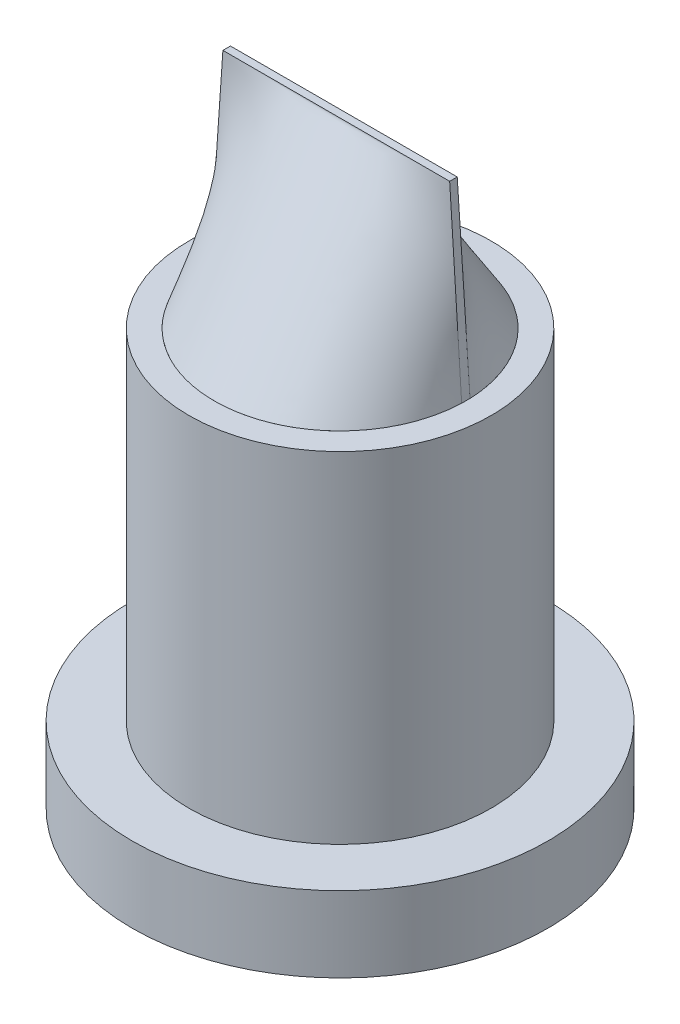
from build123d import *


with BuildPart() as part:
    # Sketch1 → Revolve1 (revolve)
    with BuildSketch(Plane(origin=(0, 0, 0), x_dir=(0, 0, -1), z_dir=(1, 0, 0))):
        Polygon((-4, 5.5), (-4, -3.5), (-5.5, -3.5), (-5.5, -5.5), (-3.33, -5.5), (-3.33, 5.5), align=None)
    revolve(axis=Axis((0, 12.686003097, 0), (0, -1, 0)))


with BuildPart() as body_2:
    # Loft4: read off the stored shape, not the designer's step
    # Loft4: loft between two sections, ruled curve by curve
    loft4_from = [
        Edge.make_bspline([(3.32815154, 5.5, 0.110938385), (3.318911807, 5.5, 0.388130394), (3.274678471, 5.5, 0.699349139), (3.056316005, 5.5, 1.368042684), (2.880471964, 5.5, 1.726573501), (2.475279036, 5.5, 2.238126983), (2.316834304, 5.5, 2.403631028), (1.952745557, 5.5, 2.707757024), (1.747027053, 5.5, 2.846242788), (1.295902616, 5.5, 3.07796003), (1.050526711, 5.5, 3.171005139), (0.536696829, 5.5, 3.297095157), (0.268404124, 5.5, 3.33), (-0.268404124, 5.5, 3.33), (-0.536696829, 5.5, 3.297095157), (-1.050526711, 5.5, 3.171005139), (-1.295902616, 5.5, 3.07796003), (-1.747027053, 5.5, 2.846242788), (-1.952745557, 5.5, 2.707757024), (-2.316834304, 5.5, 2.403631028), (-2.475279036, 5.5, 2.238126983), (-2.880471964, 5.5, 1.726573501), (-3.056316005, 5.5, 1.368042684), (-3.274678471, 5.5, 0.699349139), (-3.318911807, 5.5, 0.388130394), (-3.32815154, 5.5, 0.110938385)], [0, 0, 0, 0, 0.125, 0.125, 0.25, 0.25, 0.3125, 0.3125, 0.375, 0.375, 0.4375, 0.4375, 0.5, 0.5, 0.5625, 0.5625, 0.625, 0.625, 0.6875, 0.6875, 0.75, 0.75, 0.875, 0.875, 1, 1, 1, 1], 3),
        Edge.make_bspline([(3.32815154, 5.5, -0.110938385), (3.329383505, 5.5, -0.07397945), (3.329999487, 5.5, -0.036989725), (3.329999487, 5.5, 0.036989725), (3.329383505, 5.5, 0.07397945), (3.32815154, 5.5, 0.110938385)], [0, 0, 0, 0, 0.5, 0.5, 1, 1, 1, 1], 3),
        Edge.make_bspline([(-3.32815154, 5.5, -0.110938385), (-3.318911807, 5.5, -0.388130394), (-3.274678471, 5.5, -0.699349139), (-3.056316005, 5.5, -1.368042684), (-2.880471964, 5.5, -1.726573501), (-2.475279036, 5.5, -2.238126983), (-2.316834304, 5.5, -2.403631028), (-1.952745557, 5.5, -2.707757024), (-1.747027053, 5.5, -2.846242788), (-1.295902616, 5.5, -3.07796003), (-1.050526711, 5.5, -3.171005139), (-0.536696829, 5.5, -3.297095157), (-0.268404124, 5.5, -3.33), (0.268404124, 5.5, -3.33), (0.536696829, 5.5, -3.297095157), (1.050526711, 5.5, -3.171005139), (1.295902616, 5.5, -3.07796003), (1.747027053, 5.5, -2.846242788), (1.952745557, 5.5, -2.707757024), (2.316834304, 5.5, -2.403631028), (2.475279036, 5.5, -2.238126983), (2.880471964, 5.5, -1.726573501), (3.056316005, 5.5, -1.368042684), (3.274678471, 5.5, -0.699349139), (3.318911807, 5.5, -0.388130394), (3.32815154, 5.5, -0.110938385)], [0, 0, 0, 0, 0.125, 0.125, 0.25, 0.25, 0.3125, 0.3125, 0.375, 0.375, 0.4375, 0.4375, 0.5, 0.5, 0.5625, 0.5625, 0.625, 0.625, 0.6875, 0.6875, 0.75, 0.75, 0.875, 0.875, 1, 1, 1, 1], 3),
        Edge.make_bspline([(-3.32815154, 5.5, 0.110938385), (-3.329383505, 5.5, 0.07397945), (-3.329999487, 5.5, 0.036989725), (-3.329999487, 5.5, -0.036989725), (-3.329383505, 5.5, -0.07397945), (-3.32815154, 5.5, -0.110938385)], [0, 0, 0, 0, 0.5, 0.5, 1, 1, 1, 1], 3),
    ]
    loft4_to = [
        Edge.make_bspline([(3, 10.416151902, 0.1), (2.75, 10.416151902, 0.1), (2.5, 10.416151902, 0.1), (2, 10.416151902, 0.1), (1.75, 10.416151902, 0.1), (1.375, 10.416151902, 0.1), (1.25, 10.416151902, 0.1), (1, 10.416151902, 0.1), (0.875, 10.416151902, 0.1), (0.625, 10.416151902, 0.1), (0.5, 10.416151902, 0.1), (0.25, 10.416151902, 0.1), (0.125, 10.416151902, 0.1), (-0.125, 10.416151902, 0.1), (-0.25, 10.416151902, 0.1), (-0.5, 10.416151902, 0.1), (-0.625, 10.416151902, 0.1), (-0.875, 10.416151902, 0.1), (-1, 10.416151902, 0.1), (-1.25, 10.416151902, 0.1), (-1.375, 10.416151902, 0.1), (-1.75, 10.416151902, 0.1), (-2, 10.416151902, 0.1), (-2.5, 10.416151902, 0.1), (-2.75, 10.416151902, 0.1), (-3, 10.416151902, 0.1)], [0, 0, 0, 0, 0.125, 0.125, 0.25, 0.25, 0.3125, 0.3125, 0.375, 0.375, 0.4375, 0.4375, 0.5, 0.5, 0.5625, 0.5625, 0.625, 0.625, 0.6875, 0.6875, 0.75, 0.75, 0.875, 0.875, 1, 1, 1, 1], 3),
        Edge.make_bspline([(3, 10.416151902, -0.1), (3, 10.416151902, -0.066666667), (3, 10.416151902, -0.033333333), (3, 10.416151902, 0.033333333), (3, 10.416151902, 0.066666667), (3, 10.416151902, 0.1)], [0, 0, 0, 0, 0.5, 0.5, 1, 1, 1, 1], 3),
        Edge.make_bspline([(-3, 10.416151902, -0.1), (-2.75, 10.416151902, -0.1), (-2.5, 10.416151902, -0.1), (-2, 10.416151902, -0.1), (-1.75, 10.416151902, -0.1), (-1.375, 10.416151902, -0.1), (-1.25, 10.416151902, -0.1), (-1, 10.416151902, -0.1), (-0.875, 10.416151902, -0.1), (-0.625, 10.416151902, -0.1), (-0.5, 10.416151902, -0.1), (-0.25, 10.416151902, -0.1), (-0.125, 10.416151902, -0.1), (0.125, 10.416151902, -0.1), (0.25, 10.416151902, -0.1), (0.5, 10.416151902, -0.1), (0.625, 10.416151902, -0.1), (0.875, 10.416151902, -0.1), (1, 10.416151902, -0.1), (1.25, 10.416151902, -0.1), (1.375, 10.416151902, -0.1), (1.75, 10.416151902, -0.1), (2, 10.416151902, -0.1), (2.5, 10.416151902, -0.1), (2.75, 10.416151902, -0.1), (3, 10.416151902, -0.1)], [0, 0, 0, 0, 0.125, 0.125, 0.25, 0.25, 0.3125, 0.3125, 0.375, 0.375, 0.4375, 0.4375, 0.5, 0.5, 0.5625, 0.5625, 0.625, 0.625, 0.6875, 0.6875, 0.75, 0.75, 0.875, 0.875, 1, 1, 1, 1], 3),
        Edge.make_bspline([(-3, 10.416151902, 0.1), (-3, 10.416151902, 0.066666667), (-3, 10.416151902, 0.033333333), (-3, 10.416151902, -0.033333333), (-3, 10.416151902, -0.066666667), (-3, 10.416151902, -0.1)], [0, 0, 0, 0, 0.5, 0.5, 1, 1, 1, 1], 3),
    ]
    loft4 = Solid(Shell([*[Face.make_surface_from_curves(loft4_from[k], loft4_to[k]) for k in range(4)], Face(Wire(loft4_from)), Face(Wire(loft4_to))]))
    add(loft4)


solid = Compound([part.part, body_2.part])
